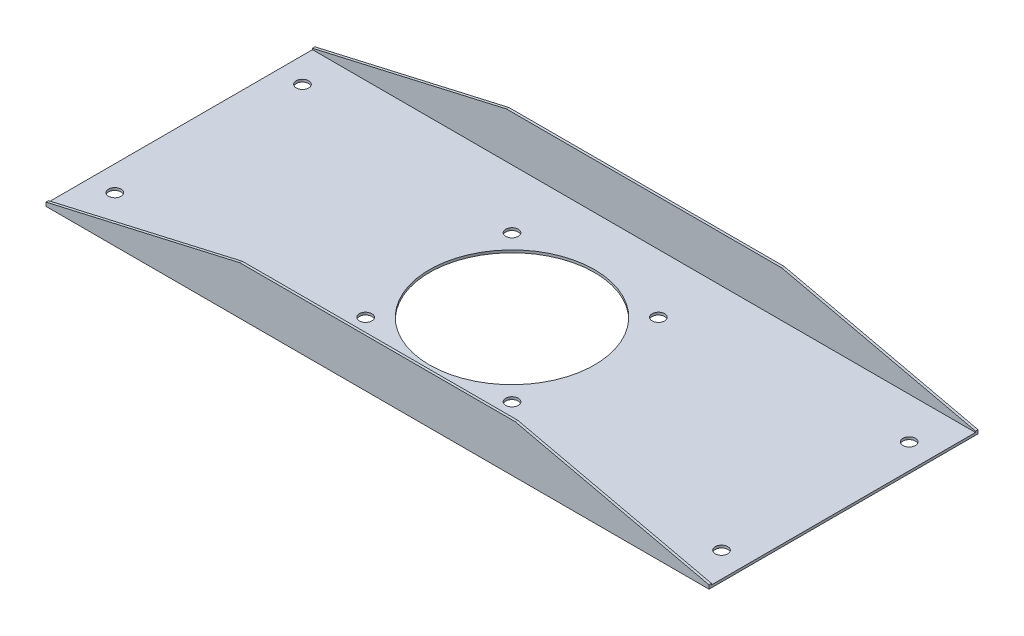
from build123d import *

# Parameters (mm, degrees)
EXTRUDE_1_DEPTH     = 530
SKETCH_2_OUTSIDE_W  = 646.648
SKETCH_2_OUTSIDE_H  = 155.148
CUT_EXTRUDE_2_DEPTH = 574.242749627
SKETCH_3_R          = 5
SKETCH_3_R_2        = 66
CUT_EXTRUDE_3_DEPTH = 543.523962604


with BuildPart() as part:
    # Эскиз1 → Вытянуть-Тонкостенный1 (new body)
    with BuildSketch(Plane(origin=(0, 0, 0), x_dir=(0, 0, -1), z_dir=(1, 0, 0))):
        Polygon((-105, 38.5), (-105, 0), (110, 0), (110, 38.5), (108, 38.5), (108, 2), (-103, 2), (-103, 38.5), align=None)
    extrude(amount=EXTRUDE_1_DEPTH)

    # Эскиз2 outside → Вырез-Вытянуть2 (cut, through all)
    with BuildSketch(Plane(origin=(0, 0, -110), x_dir=(-1, 0, 0), z_dir=(0, 0, -1))):
        with Locations((-265, 19.25)):
            Rectangle(SKETCH_2_OUTSIDE_W, SKETCH_2_OUTSIDE_H)
        Polygon((-530, 0), (-530, 3), (-375, 38.5), (-155, 38.5), (0, 3), (0, 0), align=None, mode=Mode.SUBTRACT)
    extrude(amount=-CUT_EXTRUDE_2_DEPTH, mode=Mode.SUBTRACT)

    # Эскиз3 → Вырез-Вытянуть3 (cut, through all)
    with BuildSketch(Plane(origin=(0, 2, 0), x_dir=(1, 0, 0), z_dir=(0, 1, 0))):
        with Locations((20, 80)):
            Circle(SKETCH_3_R)
        with Locations((20, -70)):
            Circle(SKETCH_3_R)
        with Locations((510, 75)):
            Circle(SKETCH_3_R)
        with Locations((510, -75)):
            Circle(SKETCH_3_R)
        with Locations((265, 2.5)):
            Circle(SKETCH_3_R_2)
        with Locations((323.513972874, 61.013972874)):
            Circle(SKETCH_3_R)
        with Locations((323.513972874, -56.013972874)):
            Circle(SKETCH_3_R)
        with Locations((206.486027126, -56.013972874)):
            Circle(SKETCH_3_R)
        with Locations((206.486027126, 61.013972874)):
            Circle(SKETCH_3_R)
    extrude(amount=-CUT_EXTRUDE_3_DEPTH, mode=Mode.SUBTRACT)


solid = part.part
